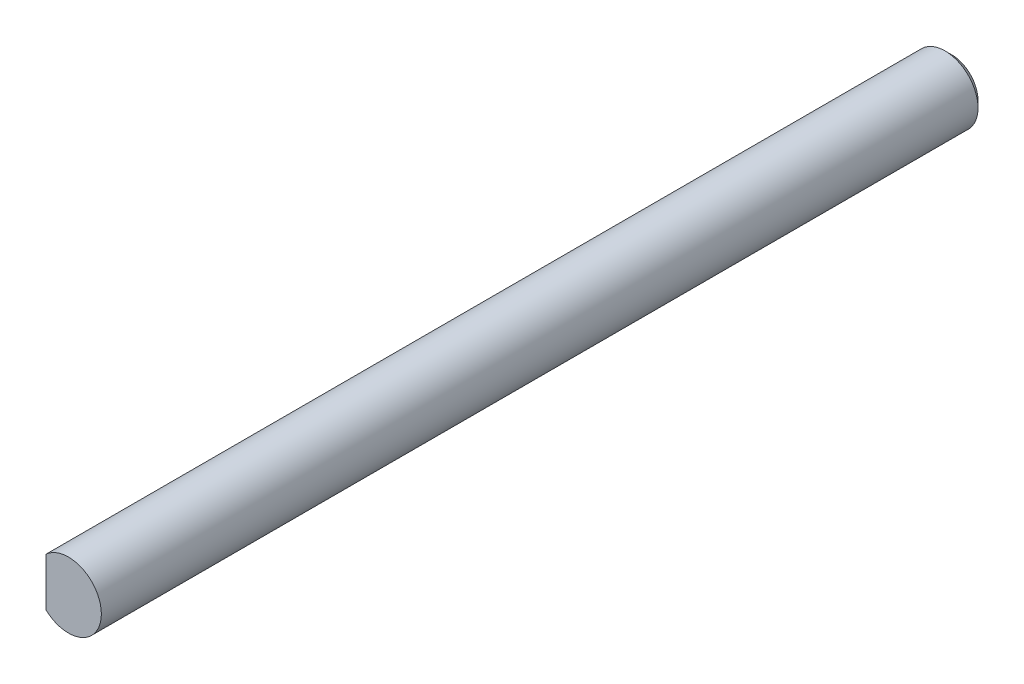
from build123d import *

# Parameters (mm, degrees)
CROQUIS1_R              = 2.5
SALIENTE_EXTRUIR1_DEPTH = 67
CUT_EXTRUDE1_START      = -15
CUT_EXTRUDE1_DEPTH      = 15
CHAMFER1_SIZE           = 0.5


with BuildPart() as part:
    # Croquis1 → Saliente-Extruir1 (new body)
    with BuildSketch(Plane.XY):
        Circle(CROQUIS1_R)
    extrude(amount=SALIENTE_EXTRUIR1_DEPTH)

    # Sketch1 → Cut-Extrude1 (cut)
    with BuildSketch(Plane.XY.offset(67).offset(CUT_EXTRUDE1_START)):
        with BuildLine():
            Line((-1.7, 1.833030278), (-1.7, -1.833030278))
            ThreePointArc((-1.7, -1.833030278), (-2.5, 0), (-1.7, 1.833030278))
        make_face()
    extrude(amount=CUT_EXTRUDE1_DEPTH, mode=Mode.SUBTRACT)

    # Chamfer1
    chamfer1_edges = [part.edges().sort_by_distance(p)[0] for p in [
        (-2.5, 0, 0),
    ]]
    chamfer(chamfer1_edges, length=CHAMFER1_SIZE)


solid = part.part
